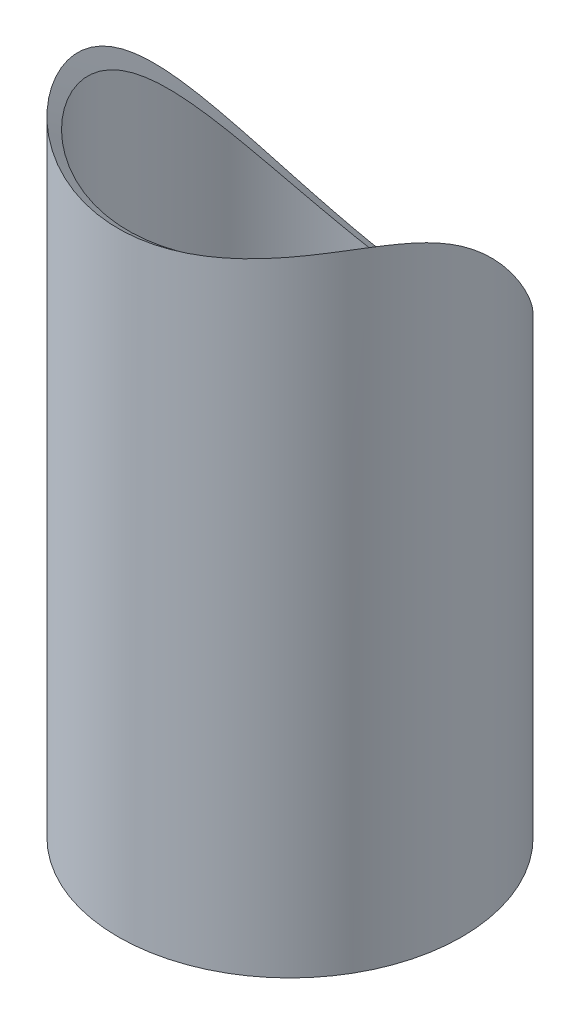
from build123d import *

# Parameters (mm, degrees)
EXTRUDE_1_OUTLINE_R      = 50
EXTRUDE_1_OUTLINE_R_2    = 47
EXTRUDE_1_DEPTH          = 200
CUT_EXTRUDE_1_DEPTH      = 213.132034356
CUT_EXTRUDE_1_DEPTH_BACK = 213.132034356
SKETCH_2_R               = 62.5


# Read off the part's stored shape, not the designer's step: Вытянуть-Тонкостенный1
with BuildPart() as part:
    # Вытянуть-Тонкостенный1 outline → Вытянуть-Тонкостенный1 (new body)
    with BuildSketch(Plane(origin=(0, 0, 0), x_dir=(1, 0, 0), z_dir=(0, 1, 0))):
        Circle(EXTRUDE_1_OUTLINE_R)
        Circle(EXTRUDE_1_OUTLINE_R_2, mode=Mode.SUBTRACT)
    extrude(amount=EXTRUDE_1_DEPTH)

    # Эскиз2 → Вырез-Вытянуть1 (cut, two sides: drawn at the far end of the back side and taken through both)
    with BuildSketch(Plane(origin=(0, 0, 0), x_dir=(1, 0, 0), z_dir=(0, -0.5735764363510444, -0.819152044288993)).offset(-CUT_EXTRUDE_1_DEPTH_BACK)):
        with Locations((0, -180)):
            Circle(SKETCH_2_R)
    extrude(amount=CUT_EXTRUDE_1_DEPTH + CUT_EXTRUDE_1_DEPTH_BACK, mode=Mode.SUBTRACT)


solid = part.part
